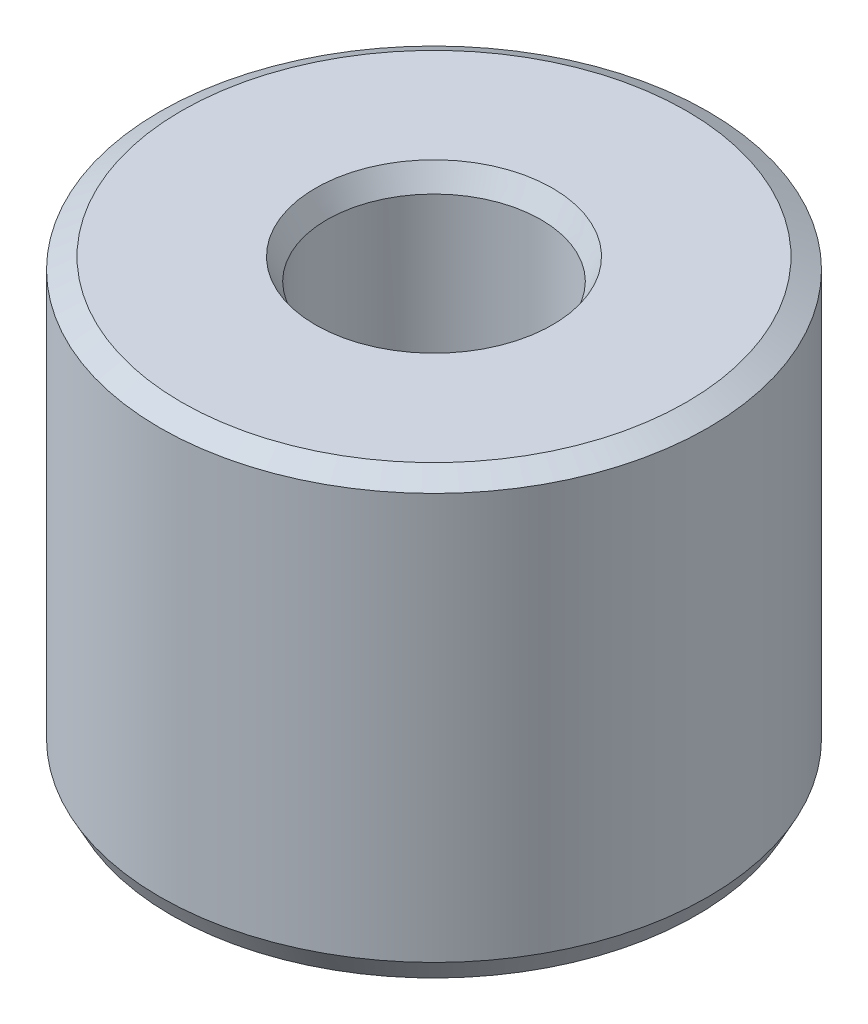
from build123d import *
from OCP.BRepFilletAPI import BRepFilletAPI_MakeChamfer

# Parameters (mm, degrees)
SKETCH1_R           = 45
BOSS_EXTRUDE1_DEPTH = 72.128112293
SKETCH2_R           = 17.577116889
CUT_EXTRUDE1_DEPTH  = 97.189732212
CHAMFER1_SIZE       = 1.880741874
CHAMFER1_SIZE2      = 3.541160582


with BuildPart() as part:
    # Sketch1 → Boss-Extrude1 (new body)
    with BuildSketch(Plane(origin=(0, 0, 0), x_dir=(1, 0, 0), z_dir=(0, 1, 0))):
        Circle(SKETCH1_R)
    extrude(amount=BOSS_EXTRUDE1_DEPTH)

    # Sketch2 → Cut-Extrude1 (cut, through all)
    with BuildSketch(Plane(origin=(0, 0, 0), x_dir=(1, 0, 0), z_dir=(0, 1, 0))):
        Circle(SKETCH2_R)
    extrude(amount=CUT_EXTRUDE1_DEPTH, mode=Mode.SUBTRACT)

    # Chamfer1: one chamfer whose edges measure the first distance from different faces: ONE call of the kernel's chamfer builder (chamfer() names one face for all edges)
    chamfer1_edges_1 = [part.edges().sort_by_distance(p)[0] for p in [
        (-17.577116889, 72.128112293, 0),
    ]]
    chamfer1_side_1 = [part.faces().sort_by_distance(p)[0] for p in [
        (-43.727207794, 72.128112293, 0),
    ]]
    chamfer1_edges_2 = [part.edges().sort_by_distance(p)[0] for p in [
        (-17.577116889, 0, 0),
    ]]
    chamfer1_side_2 = [part.faces().sort_by_distance(p)[0] for p in [
        (-17.577116889, 36.064056147, 0),
    ]]
    chamfer1_edges_3 = [part.edges().sort_by_distance(p)[0] for p in [
        (-45, 0, 0),
    ]]
    chamfer1_side_3 = [part.faces().sort_by_distance(p)[0] for p in [
        (-43.727207794, 0, 0),
    ]]
    chamfer1_edges_4 = [part.edges().sort_by_distance(p)[0] for p in [
        (-45, 72.128112293, 0),
    ]]
    chamfer1_side_4 = [part.faces().sort_by_distance(p)[0] for p in [
        (-45, 36.064056147, 0),
    ]]
    chamfer1 = BRepFilletAPI_MakeChamfer(part.part.solid().wrapped)
    for e in chamfer1_edges_1:
        chamfer1.Add(CHAMFER1_SIZE, CHAMFER1_SIZE2, e.wrapped, chamfer1_side_1[0].wrapped)  # the first distance lies on this face
    for e in chamfer1_edges_2:
        chamfer1.Add(CHAMFER1_SIZE, CHAMFER1_SIZE2, e.wrapped, chamfer1_side_2[0].wrapped)  # the first distance lies on this face
    for e in chamfer1_edges_3:
        chamfer1.Add(CHAMFER1_SIZE, CHAMFER1_SIZE2, e.wrapped, chamfer1_side_3[0].wrapped)  # the first distance lies on this face
    for e in chamfer1_edges_4:
        chamfer1.Add(CHAMFER1_SIZE, CHAMFER1_SIZE2, e.wrapped, chamfer1_side_4[0].wrapped)  # the first distance lies on this face
    add(Compound.cast(chamfer1.Shape()), mode=Mode.REPLACE)


solid = part.part
